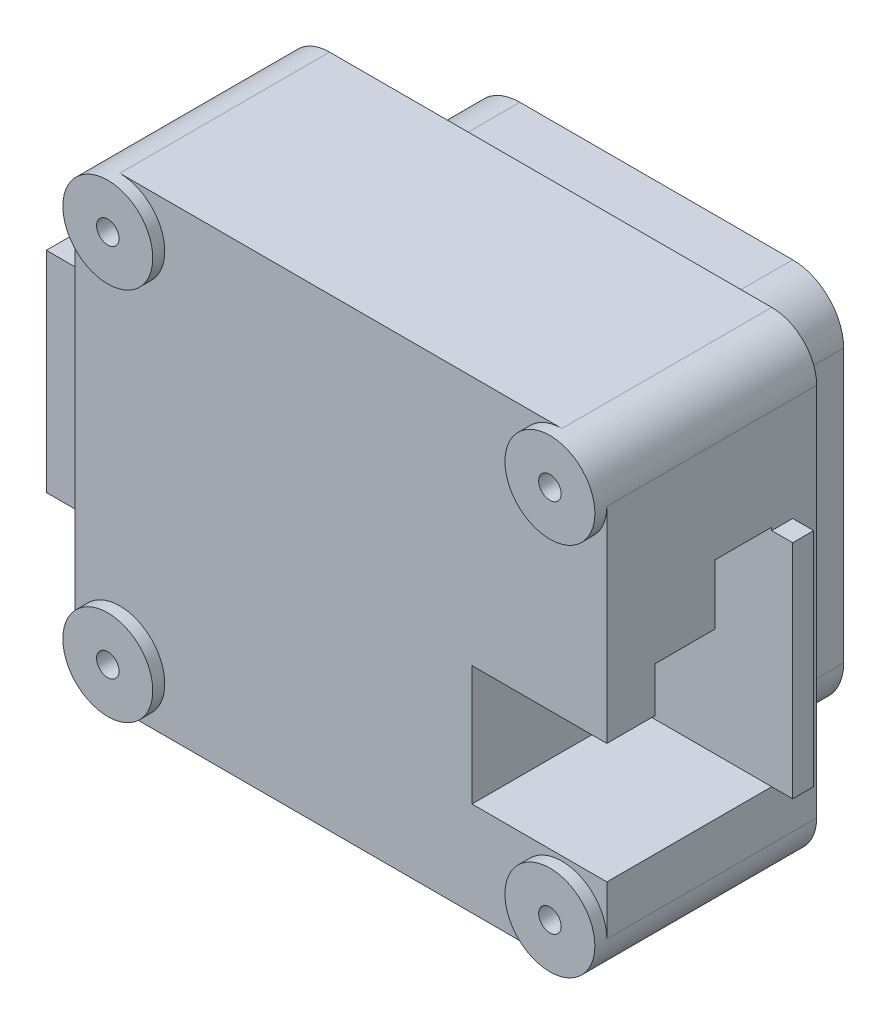
from build123d import *

# Parameters (mm, degrees)
BOSS_EXTRUDE1_DEPTH  = 14
BOSS_EXTRUDE5_DEPTH  = 3.5
SKETCH11_R           = 2.9999999999999982
BOSS_EXTRUDE6_DEPTH  = 1.5
SKETCH11_2_R         = 2.9999999999999982
CUT_EXTRUDE1_DEPTH   = 1.6
BOSS_EXTRUDE7_DEPTH  = 9
BOSS_EXTRUDE8_DEPTH  = 9
FILLET1_R            = 3
BOSS_EXTRUDE10_START = 0.8
SKETCH15_R           = 3.0000000000000013
SKETCH15_R_2         = 3
SKETCH15_R_3         = 3.0000000000000004
SKETCH15_R_4         = 3.0000000000000018
BOSS_EXTRUDE10_DEPTH = 0.8
SKETCH16_R           = 0.7500000000000009
SKETCH16_R_2         = 0.7500000000000007
SKETCH16_R_3         = 0.7499999999999986
SKETCH16_R_4         = 0.7499999999999987
CUT_EXTRUDE2_DEPTH   = 5
SKETCH17_W           = 3.999999999999999
SKETCH17_H           = 4
BOSS_EXTRUDE11_DEPTH = 9
BOSS_EXTRUDE12_DEPTH = 6.3
SKETCH19_R           = 11.800000000000002
CUT_EXTRUDE3_DEPTH   = 4
SKETCH20_R           = 8.000000000000002
BOSS_EXTRUDE13_DEPTH = 4
BOSS_EXTRUDE14_DEPTH = 1.4


with BuildPart() as part:
    # Sketch1 → Boss-Extrude1 (new body)
    with BuildSketch(Plane.XY):
        Polygon((0, 0), (35.5, 0), (35.5, 6.3), (26.499999999999996, 6.3), (26.499999999999996, 21.3), (35.5, 21.3), (35.5, 31.000000000000004), (-3.83e-15, 31.000000000000004), align=None)
    extrude(amount=BOSS_EXTRUDE1_DEPTH)

    # Sketch10 → Boss-Extrude5 (add)
    with BuildSketch(Plane.ZY):
        Polygon((0, 22.500000000000004), (12.4, 22.500000000000004), (12.4, 8.500000000000002), (1.71e-15, 8.500000000000002), align=None)
    extrude(amount=BOSS_EXTRUDE5_DEPTH)

    # Sketch11 → Boss-Extrude6 (add)
    with BuildSketch(Plane.ZY.offset(3.5)):
        with Locations((6.200000000000002, 15.500000000000004)):
            Circle(SKETCH11_R)
    extrude(amount=-BOSS_EXTRUDE6_DEPTH)

    # Sketch11<2> → Cut-Extrude1 (cut)
    with BuildSketch(Plane.ZY.offset(3.5)):
        with Locations((6.200000000000002, 15.500000000000004)):
            Circle(SKETCH11_2_R)
    extrude(amount=-CUT_EXTRUDE1_DEPTH, mode=Mode.SUBTRACT)

    # Sketch12 → Boss-Extrude7 (add)
    with BuildSketch(Plane(origin=(26.499999999999996, 0, 0), x_dir=(0, 0, -1), z_dir=(1, 0, 0))):
        Polygon((0, 21.3), (-3, 21.3), (-2.999999999999999, 6.299999999999998), (-6.6e-16, 6.299999999999998), align=None)
    extrude(amount=BOSS_EXTRUDE7_DEPTH)

    # Sketch13 → Boss-Extrude8 (add)
    with BuildSketch(Plane(origin=(26.499999999999996, 0, 0), x_dir=(0, 0, -1), z_dir=(1, 0, 0))):
        Polygon((-14, 21.3), (-10.800000000000002, 21.3), (-10.800000000000002, 14.300000000000002), (-14.000000000000002, 14.3), align=None)
    extrude(amount=BOSS_EXTRUDE8_DEPTH)

    # Fillet1
    fillet1_edges = [part.edges().sort_by_distance(p)[0] for p in [
        (0, 0, 7),
        (35.5, 0, 7),
        (35.5, 31.000000000000004, 7),
        (-3.83e-15, 31.000000000000004, 7),
    ]]
    fillet(fillet1_edges, radius=FILLET1_R)

    # Sketch15 → Boss-Extrude10 (add)
    with BuildSketch(Plane.XY.offset(14).offset(BOSS_EXTRUDE10_START)):
        with Locations((32.49999999999999, 2.999999999999999)):
            Circle(SKETCH15_R)
        with Locations((2.999999999999999, 3)):
            Circle(SKETCH15_R_2)
        with Locations((2.9999999999999964, 28.000000000000004)):
            Circle(SKETCH15_R_3)
        with Locations((32.49999999999999, 28.000000000000004)):
            Circle(SKETCH15_R_4)
    extrude(amount=-BOSS_EXTRUDE10_DEPTH)

    # Sketch16 → Cut-Extrude2 (cut)
    with BuildSketch(Plane.XY.offset(14.8)):
        with Locations((2.9999999999999964, 28.000000000000004)):
            Circle(SKETCH16_R)
        with Locations((2.999999999999999, 3)):
            Circle(SKETCH16_R_2)
        with Locations((32.49999999999999, 2.999999999999999)):
            Circle(SKETCH16_R_3)
        with Locations((32.49999999999999, 28.000000000000004)):
            Circle(SKETCH16_R_4)
    extrude(amount=-CUT_EXTRUDE2_DEPTH, mode=Mode.SUBTRACT)

    # Sketch17 → Boss-Extrude11 (add)
    with BuildSketch(Plane(origin=(26.499999999999996, 0, 0), x_dir=(0, 0, -1), z_dir=(1, 0, 0))):
        with Locations((-8.800000000000002, 19.3)):
            Rectangle(SKETCH17_W, SKETCH17_H)
    extrude(amount=BOSS_EXTRUDE11_DEPTH)

    # Sketch18 → Boss-Extrude12 (add)
    with BuildSketch(Plane(origin=(0, 0, 0), x_dir=(-1, 0, 0), z_dir=(0, 0, -1))):
        with BuildLine():
            Line((-9.386280913258961, 3.15), (-27.599999999999998, 3.1499999999999964))
            ThreePointArc((-27.599999999999998, 3.1499999999999964), (-30.00416305603426, 4.145836943965737), (-30.999999999999996, 6.549999999999997))
            Line((-30.999999999999996, 6.549999999999997), (-30.999999999999993, 24.749999999999996))
            ThreePointArc((-30.999999999999993, 24.749999999999996), (-30.00416305603426, 27.154163056034264), (-27.599999999999994, 28.150000000000002))
            Line((-27.599999999999994, 28.150000000000002), (-9.399999999999995, 28.150000000000002))
            ThreePointArc((-9.399999999999995, 28.150000000000002), (-6.995836943965732, 27.154163056034264), (-5.999999999999993, 24.75))
            Line((-5.999999999999993, 24.75), (-5.999999999999993, 6.53628091325897))
            ThreePointArc((-5.999999999999993, 6.53628091325897), (-6.991818716490969, 4.141818716490977), (-9.386280913258961, 3.15))
        make_face()
    extrude(amount=BOSS_EXTRUDE12_DEPTH)

    # Sketch19 → Cut-Extrude3 (cut)
    with BuildSketch(Plane(origin=(0, 0, -6.3), x_dir=(-1, 0, 0), z_dir=(0, 0, -1))):
        with Locations((-18.499999999999993, 15.64657022831474)):
            Circle(SKETCH19_R)
    extrude(amount=-CUT_EXTRUDE3_DEPTH, mode=Mode.SUBTRACT)

    # Sketch20 → Boss-Extrude13 (add)
    with BuildSketch(Plane(origin=(0, 0, -2.3), x_dir=(-1, 0, 0), z_dir=(0, 0, -1))):
        with Locations((-18.496570228314738, 15.649999999999997)):
            Circle(SKETCH20_R)
    extrude(amount=BOSS_EXTRUDE13_DEPTH)

    # Sketch23 → Boss-Extrude14 (add)
    with BuildSketch(Plane(origin=(35.5, 0, 0), x_dir=(0, 0, -1), z_dir=(1, 0, 0))):
        Polygon((-1.600000000000001, 21.1), (-3.000000000000001, 21.1), (-2.999999999999999, 6.300000000000002), (-1.5999999999999992, 6.300000000000002), align=None)
    extrude(amount=BOSS_EXTRUDE14_DEPTH)


solid = part.part
